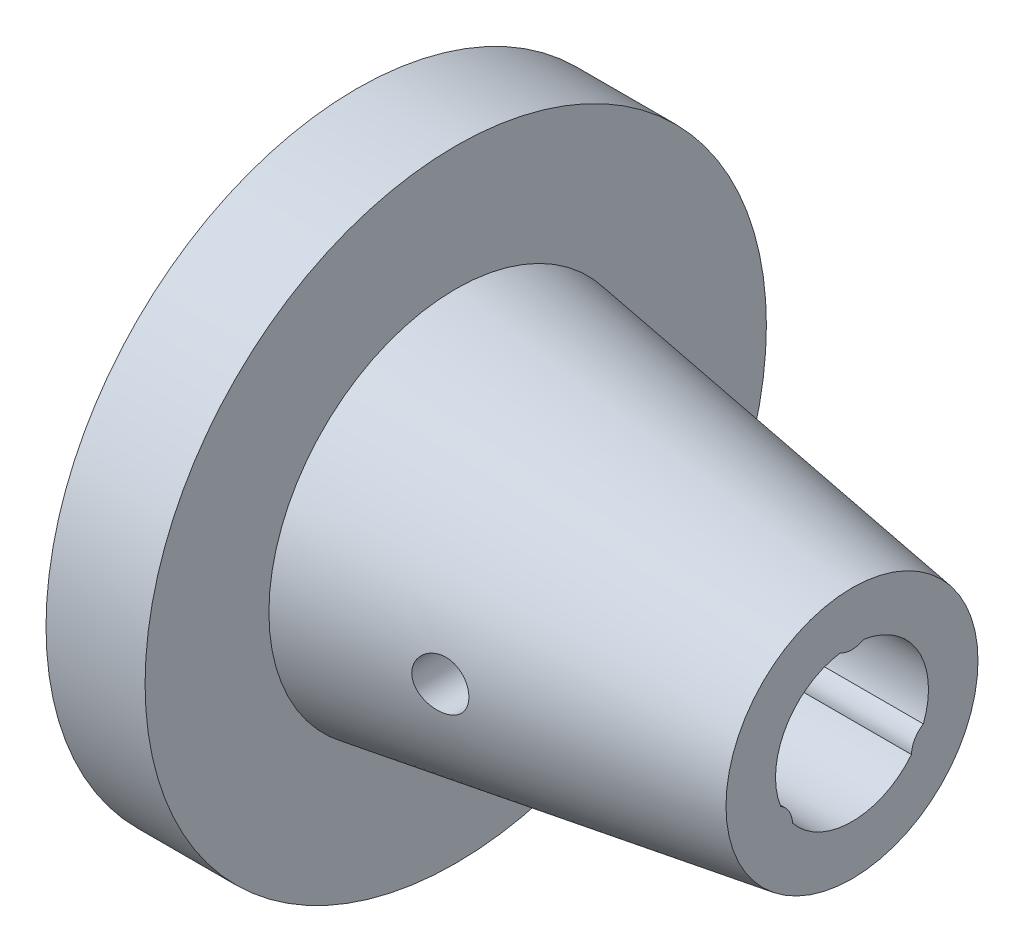
from build123d import *

# Parameters (mm, degrees)
BOSS_EXTRUDE2_DEPTH      = 6.35
FILLET1_R                = 0.254
CIRPATTERN3_COUNT        = 3
FILLET1_OF_CIRPATTERN3_R = 0.254
CUT_EXTRUDE1_DEPTH       = 22.220069761
CUT_EXTRUDE1_DEPTH_BACK  = 22.220069761
SKETCH6_R                = 0.79375


with BuildPart() as part:
    # Sketch3 → Revolve1 (revolve)
    with BuildSketch(Plane.XY, mode=Mode.PRIVATE) as revolve1_sk:
        Polygon((0, 9.9568), (0, 2.4511), (15.875, 2.4511), (15.875, 4.0386), (3.175, 5.98805), (3.175, 9.9568), align=None)
    revolve(revolve1_sk.sketch.rotate(Axis((0, 0, 0), (1, 0, 0)), 90), axis=Axis((0, 0, 0), (1, 0, 0)))

    # Sketch5 → Boss-Extrude2 (add)
    with BuildSketch(Plane.ZY.offset(-15.875)):
        with BuildLine():
            ThreePointArc((-0.381, 2.421307541), (0, 2.4511), (0.381, 2.421307541))
            ThreePointArc((0.381, 2.421307541), (0, 2.3241), (-0.381, 2.421307541))
        make_face()
    boss_extrude2 = extrude(amount=BOSS_EXTRUDE2_DEPTH)

    # Fillet1
    # the kernel refuses this fillet: 0.254 mm, written as the material it takes off along each edge
    with BuildSketch(Plane(origin=(9.525, 3.119358803, 0), x_dir=(0, -0.2692049658318269, 0.9630829073197619), z_dir=(0, 0.9630829073197619, 0.2692049658318269))) as fillet1_piece_1_section:
        with BuildLine():
            CenterArc((0.795258803 - FILLET1_R, FILLET1_R), FILLET1_R, 270, 90)
            Line((0.795258803 - FILLET1_R, 0), (0.795258803, 0))
            Line((0.795258803, 0), (0.795258803, FILLET1_R))
        make_face()
    fillet1_piece_1 = revolve(axis=Axis((9.525, 3.119358803, 0), (1, 0, 0)), revolution_arc=148.766073655, mode=Mode.PRIVATE)
    fillet1_piece_1 = fillet1_piece_1 & Plane(origin=(9.597702858, 0, 0), x_dir=(0, 0, 1), z_dir=(1, 0, 0)) * Cylinder(2.4511, 4, mode=Mode.PRIVATE)
    add(fillet1_piece_1, mode=Mode.SUBTRACT)

    # CirPattern3: Boss-Extrude2 ×3 about axis
    cirpattern3_axis = Axis((0, 0, 0), (1, 0, 0))
    for i in range(1, CIRPATTERN3_COUNT):
        add(boss_extrude2.rotate(cirpattern3_axis, i * 360 / CIRPATTERN3_COUNT))

    # Fillet1 of CirPattern3
    # the kernel refuses this fillet: 0.254 mm, written as the material it takes off along each edge
    with BuildSketch(Plane(origin=(9.525, -1.559679402, 2.701443967), x_dir=(0, -0.699451780773575, -0.7146797928951643), z_dir=(0, -0.7146797928951643, 0.699451780773575))) as fillet1_of_cirpattern3_piece_1_section:
        with BuildLine():
            CenterArc((0.795258803 - FILLET1_OF_CIRPATTERN3_R, FILLET1_OF_CIRPATTERN3_R), FILLET1_OF_CIRPATTERN3_R, 270, 90)
            Line((0.795258803 - FILLET1_OF_CIRPATTERN3_R, 0), (0.795258803, 0))
            Line((0.795258803, 0), (0.795258803, FILLET1_OF_CIRPATTERN3_R))
        make_face()
    fillet1_of_cirpattern3_piece_1 = revolve(axis=Axis((9.525, -1.559679402, 2.701443967), (1, 0, 0)), revolution_arc=148.766073655, mode=Mode.PRIVATE)
    fillet1_of_cirpattern3_piece_1 = fillet1_of_cirpattern3_piece_1 & Plane(origin=(9.597702858, 0, 0), x_dir=(0, 0, 1), z_dir=(1, 0, 0)) * Cylinder(2.4511, 4, mode=Mode.PRIVATE)
    add(fillet1_of_cirpattern3_piece_1, mode=Mode.SUBTRACT)
    with BuildSketch(Plane(origin=(9.525, -1.559679402, -2.701443967), x_dir=(0, 0.968656746605401, -0.24840311442459811), z_dir=(0, -0.24840311442459811, -0.968656746605401))) as fillet1_of_cirpattern3_piece_2_section:
        with BuildLine():
            CenterArc((0.795258803 - FILLET1_OF_CIRPATTERN3_R, FILLET1_OF_CIRPATTERN3_R), FILLET1_OF_CIRPATTERN3_R, 270, 90)
            Line((0.795258803 - FILLET1_OF_CIRPATTERN3_R, 0), (0.795258803, 0))
            Line((0.795258803, 0), (0.795258803, FILLET1_OF_CIRPATTERN3_R))
        make_face()
    fillet1_of_cirpattern3_piece_2 = revolve(axis=Axis((9.525, -1.559679402, -2.701443967), (1, 0, 0)), revolution_arc=148.766073655, mode=Mode.PRIVATE)
    fillet1_of_cirpattern3_piece_2 = fillet1_of_cirpattern3_piece_2 & Plane(origin=(9.597702858, 0, 0), x_dir=(0, 0, 1), z_dir=(1, 0, 0)) * Cylinder(2.4511, 4, mode=Mode.PRIVATE)
    add(fillet1_of_cirpattern3_piece_2, mode=Mode.SUBTRACT)

    # Sketch6 → Cut-Extrude1 (cut, two sides: drawn at the far end of the back side and taken through both)
    with BuildSketch(Plane.XY.offset(-CUT_EXTRUDE1_DEPTH_BACK)):
        with Locations((7.9375, 0)):
            Circle(SKETCH6_R)
    extrude(amount=CUT_EXTRUDE1_DEPTH + CUT_EXTRUDE1_DEPTH_BACK, mode=Mode.SUBTRACT)


solid = part.part
